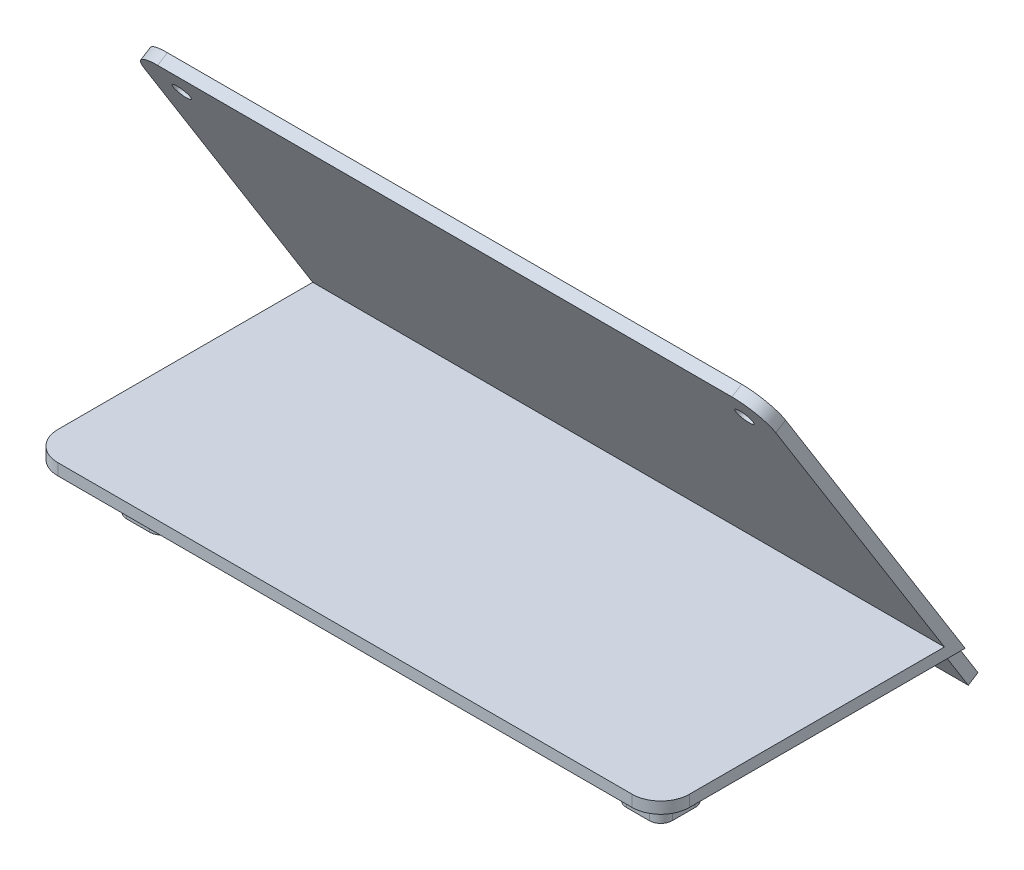
from build123d import *

# Parameters (mm, degrees)
SKETCH1_W           = 110
SKETCH1_H           = 53
BOSS_EXTRUDE1_DEPTH = 2
SKETCH2_R           = 1.5
BOSS_EXTRUDE2_DEPTH = 2
SKETCH3_W           = 110
SKETCH3_H           = 2.5
CUT_EXTRUDE1_DEPTH  = 2
SKETCH8_W           = 8
SKETCH8_H           = 8
SKETCH8_R           = 1.5
BOSS_EXTRUDE5_DEPTH = 8
FILLET1_R           = 5
FILLET2_R           = 2


with BuildPart() as part:
    # Sketch1 → Boss-Extrude1 (new body)
    with BuildSketch(Plane(origin=(0, 0, 0), x_dir=(1, 0, 0), z_dir=(0, 1, 0))):
        Rectangle(SKETCH1_W, SKETCH1_H)
    extrude(amount=BOSS_EXTRUDE1_DEPTH)

    # Sketch2 → Boss-Extrude2 (add)
    with BuildSketch(Plane(origin=(0, 11.909021113, -19.058417695), x_dir=(-1, 0, 0), z_dir=(0, 0.5299192642332059, -0.8480480961564255))):
        Polygon((-55, -12.34676431), (-55, 49.96323569), (55, 49.96323569), (55, -12.34676431), (53, -12.34676431), (53, -22.04676431), (45, -22.04676431), (-45, -22.04676431), (-53, -22.04676431), (-53, -12.34676431), align=None)
        with Locations((-49, 43.96323569)):
            Circle(SKETCH2_R, mode=Mode.SUBTRACT)
        with Locations((-49, -16.03676431)):
            Circle(SKETCH2_R, mode=Mode.SUBTRACT)
        with Locations((49, 43.96323569)):
            Circle(SKETCH2_R, mode=Mode.SUBTRACT)
        with Locations((49, -16.03676431)):
            Circle(SKETCH2_R, mode=Mode.SUBTRACT)
    extrude(amount=-BOSS_EXTRUDE2_DEPTH)

    # Sketch3 → Cut-Extrude1 (cut)
    with BuildSketch(Plane(origin=(0, 11.909021113, -19.058417695), x_dir=(-1, 0, 0), z_dir=(0, 0.5299192642332057, -0.8480480961564255))):
        with Locations((0, -12.934503695)):
            Rectangle(SKETCH3_W, SKETCH3_H)
    extrude(amount=CUT_EXTRUDE1_DEPTH, mode=Mode.SUBTRACT)

    # Sketch8 → Boss-Extrude5 (add)
    # profile 1 of 2: a face of its own
    with BuildSketch(Plane.XZ):
        with Locations((-43.5, 15)):
            Rectangle(SKETCH8_W, SKETCH8_H)
        with Locations((-43.5, 15)):
            Circle(SKETCH8_R, mode=Mode.SUBTRACT)
    # profile 2 of 2: a face of its own
    with BuildSketch(Plane.XZ):
        with Locations((43.5, 15)):
            Rectangle(SKETCH8_W, SKETCH8_H)
        with Locations((43.5, 15)):
            Circle(SKETCH8_R, mode=Mode.SUBTRACT)
    extrude(amount=BOSS_EXTRUDE5_DEPTH)

    # Fillet1
    fillet1_edges = [part.edges().sort_by_distance(p)[0] for p in [
        (55, 1, 26.5),
        (-55, 1, 26.5),
        (55, 53.750328754, 8.266111497),
        (-55, 53.750328754, 8.266111497),
    ]]
    fillet(fillet1_edges, radius=FILLET1_R)

    # Fillet2
    fillet2_edges = [part.edges().sort_by_distance(p)[0] for p in [
        (-43.5, 0, 19),
        (-43.5, 0, 11),
        (-39.5, -4, 11),
        (-39.5, -4, 19),
        (-39.5, 0, 15),
        (-47.5, -4, 19),
        (-47.5, -4, 11),
        (-47.5, 0, 15),
        (47.5, 0, 15),
        (43.5, 0, 19),
        (43.5, 0, 11),
        (47.5, -4, 19),
        (39.5, -4, 19),
        (47.5, -4, 11),
        (39.5, 0, 15),
        (39.5, -4, 11),
    ]]
    fillet(fillet2_edges, radius=FILLET2_R)


solid = part.part
